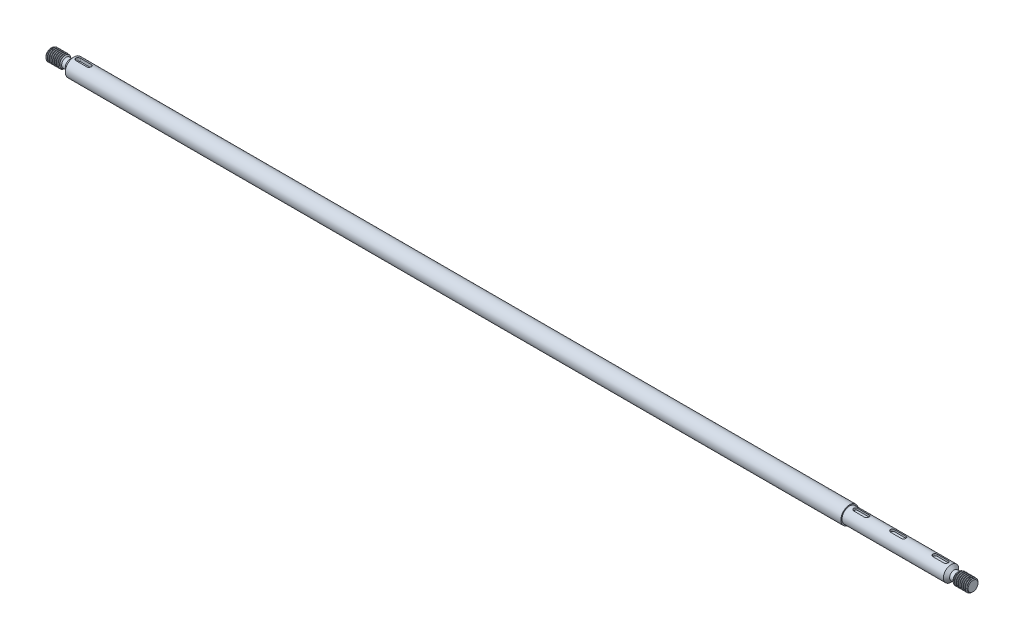
from build123d import *

# Parameters (mm, degrees)
CHAMFER1_SIZE      = 2
THREAD1_PITCH      = 3.175
CHAMFER2_SIZE      = 2
THREAD2_PITCH      = 3.175
SKETCH3_R          = 2.35
CUT_EXTRUDE2_DEPTH = 1683.108534772
CUT_EXTRUDE3_DEPTH = 10


# Read off the part's stored shape, not the designer's step: Revolve1
with BuildPart() as part:
    # Revolve1 outline → Revolve1 (revolve)
    with BuildSketch(Plane(origin=(0, -11.1125, 0), x_dir=(0, 1, 0), z_dir=(0, 0, -1))):
        Polygon((11.1125, -1681.647145633), (11.1125, -1656.647145633), (8.364004428, -1653.89865006), (8.364004428, -1647.283141205), (16, -1639.647145633), (16, -225), (14, -225), (14, -40), (8.364004428, -34.364004428), (8.364004428, -27.748495572), (11.1125, -25), (11.1125, 0), (0, 0), (0, -1681.647145633), align=None)
    revolve(axis=Axis((0, -11.1125, 0), (1, 0, 0)))

    # Chamfer1
    chamfer1_edges = [part.edges().sort_by_distance(p)[0] for p in [
        (0, -22.225, 0),
    ]]
    chamfer(chamfer1_edges, length=CHAMFER1_SIZE)

    # Thread1: the profile of Thread Profile1 profile screwed along a right-hand helix of 9.448819 turns, 12 arcs to a turn; built about Z, then put on its axis
    thread1_z = Axis((0, 0, 0), (0, 0, 1))
    thread1_corners = [(11.1128, 0, -0.000173205), (11.1128, 0, 2.778298196), (9.393980847, 0, 1.785937496), (9.393980847, 0, 0.992187496)]
    with BuildLine(mode=Mode.PRIVATE) as thread1_profile:
        Line(thread1_corners[0], thread1_corners[1])
        Line(thread1_corners[1], thread1_corners[2])
        Line(thread1_corners[2], thread1_corners[3])
        Line(thread1_corners[3], thread1_corners[0])
    thread1_cap = Face(thread1_profile.wire())
    thread1_turn_angles = [0, 15, 30, 45, 60, 75, 90, 105, 120, 135, 150, 165, 180, 195, 210, 225, 240, 255, 270, 285, 300, 315, 330, 345, 360]
    thread1_turn_weights = [1, 0.9659258262890683, 1, 0.9659258262890683, 1, 0.9659258262890683, 1, 0.9659258262890683, 1, 0.9659258262890683, 1, 0.9659258262890683, 1, 0.9659258262890683, 1, 0.9659258262890683, 1, 0.9659258262890683, 1, 0.9659258262890683, 1, 0.9659258262890683, 1, 0.9659258262890683, 1]
    thread1_turn_rails = [Edge.make_bspline([Vector(p[0], p[1], 0).rotate(thread1_z, thread1_turn_angles[k]) / thread1_turn_weights[k] + Vector(0, 0, p[2] + THREAD1_PITCH * thread1_turn_angles[k] / 360) for k in range(25)], [0, 0, 0, 1, 1, 2, 2, 3, 3, 4, 4, 5, 5, 6, 6, 7, 7, 8, 8, 9, 9, 10, 10, 11, 11, 12, 12, 12], 2, thread1_turn_weights) for p in thread1_corners]
    thread1_turn_sides = [Face.make_surface_from_curves(thread1_turn_rails[p[0]], thread1_turn_rails[p[1]]) for p in [(0, 1), (1, 2), (2, 3), (3, 0)]]
    thread1_last_angles = [3240, 3255, 3270, 3285, 3300, 3315, 3330, 3345, 3360, 3375, 3390, 3395.787401575, 3401.57480315]
    thread1_last_weights = [1, 0.9659258262890683, 1, 0.9659258262890683, 1, 0.9659258262890683, 1, 0.9659258262890683, 1, 0.9659258262890683, 1, 0.9949029054407538, 1]
    thread1_last_rails = [Edge.make_bspline([Vector(p[0], p[1], 0).rotate(thread1_z, thread1_last_angles[k]) / thread1_last_weights[k] + Vector(0, 0, p[2] + THREAD1_PITCH * thread1_last_angles[k] / 360) for k in range(13)], [0, 0, 0, 1, 1, 2, 2, 3, 3, 4, 4, 5, 5, 6, 6, 6], 2, thread1_last_weights) for p in thread1_corners]
    thread1_last_sides = [Face.make_surface_from_curves(thread1_last_rails[p[0]], thread1_last_rails[p[1]]) for p in [(0, 1), (1, 2), (2, 3), (3, 0)]]
    thread1 = Plane(origin=(-30, -11.1125, 0), x_dir=(0, 0, -1), z_dir=(1, 0, 0)) * Solid(Shell([*[p.moved(Location((0, 0, THREAD1_PITCH * i))) for i in range(9) for p in thread1_turn_sides], *thread1_last_sides, thread1_cap, thread1_cap.rotate(thread1_z, 3401.57480315).moved(Location((0, 0, THREAD1_PITCH * 3401.57480315 / 360)))]))
    add(thread1, mode=Mode.SUBTRACT)

    # Chamfer2
    chamfer2_edges = [part.edges().sort_by_distance(p)[0] for p in [
        (-1681.647145633, -22.225, 0),
    ]]
    chamfer(chamfer2_edges, length=CHAMFER2_SIZE)

    # Thread2: the profile of Thread Profile2 profile screwed along a right-hand helix of 9.448819 turns, 12 arcs to a turn; built about Z, then put on its axis
    thread2_z = Axis((0, 0, 0), (0, 0, 1))
    thread2_corners = [(11.1128, 0, -0.000173206), (11.1128, 0, 2.778298196), (9.393980847, 0, 1.785937495), (9.393980847, 0, 0.992187495)]
    with BuildLine(mode=Mode.PRIVATE) as thread2_profile:
        Line(thread2_corners[0], thread2_corners[1])
        Line(thread2_corners[1], thread2_corners[2])
        Line(thread2_corners[2], thread2_corners[3])
        Line(thread2_corners[3], thread2_corners[0])
    thread2_cap = Face(thread2_profile.wire())
    thread2_turn_angles = [0, 15, 30, 45, 60, 75, 90, 105, 120, 135, 150, 165, 180, 195, 210, 225, 240, 255, 270, 285, 300, 315, 330, 345, 360]
    thread2_turn_weights = [1, 0.9659258262890683, 1, 0.9659258262890683, 1, 0.9659258262890683, 1, 0.9659258262890683, 1, 0.9659258262890683, 1, 0.9659258262890683, 1, 0.9659258262890683, 1, 0.9659258262890683, 1, 0.9659258262890683, 1, 0.9659258262890683, 1, 0.9659258262890683, 1, 0.9659258262890683, 1]
    thread2_turn_rails = [Edge.make_bspline([Vector(p[0], p[1], 0).rotate(thread2_z, thread2_turn_angles[k]) / thread2_turn_weights[k] + Vector(0, 0, p[2] + THREAD2_PITCH * thread2_turn_angles[k] / 360) for k in range(25)], [0, 0, 0, 1, 1, 2, 2, 3, 3, 4, 4, 5, 5, 6, 6, 7, 7, 8, 8, 9, 9, 10, 10, 11, 11, 12, 12, 12], 2, thread2_turn_weights) for p in thread2_corners]
    thread2_turn_sides = [Face.make_surface_from_curves(thread2_turn_rails[p[0]], thread2_turn_rails[p[1]]) for p in [(0, 1), (1, 2), (2, 3), (3, 0)]]
    thread2_last_angles = [3240, 3255, 3270, 3285, 3300, 3315, 3330, 3345, 3360, 3375, 3390, 3395.787401575, 3401.57480315]
    thread2_last_weights = [1, 0.9659258262890683, 1, 0.9659258262890683, 1, 0.9659258262890683, 1, 0.9659258262890683, 1, 0.9659258262890683, 1, 0.9949029054407538, 1]
    thread2_last_rails = [Edge.make_bspline([Vector(p[0], p[1], 0).rotate(thread2_z, thread2_last_angles[k]) / thread2_last_weights[k] + Vector(0, 0, p[2] + THREAD2_PITCH * thread2_last_angles[k] / 360) for k in range(13)], [0, 0, 0, 1, 1, 2, 2, 3, 3, 4, 4, 5, 5, 6, 6, 6], 2, thread2_last_weights) for p in thread2_corners]
    thread2_last_sides = [Face.make_surface_from_curves(thread2_last_rails[p[0]], thread2_last_rails[p[1]]) for p in [(0, 1), (1, 2), (2, 3), (3, 0)]]
    thread2 = Plane(origin=(-1651.647145633, -11.1125, 0), x_dir=(0, 0, 1), z_dir=(-1, 0, 0)) * Solid(Shell([*[p.moved(Location((0, 0, THREAD2_PITCH * i))) for i in range(9) for p in thread2_turn_sides], *thread2_last_sides, thread2_cap, thread2_cap.rotate(thread2_z, 3401.57480315).moved(Location((0, 0, THREAD2_PITCH * 3401.57480315 / 360)))]))
    add(thread2, mode=Mode.SUBTRACT)

    # Sketch3 → Cut-Extrude2 (cut, through all)
    with BuildSketch(Plane(origin=(0, 8.8875, 0), x_dir=(1, 0, 0), z_dir=(0, 1, 0))):
        with Locations(Location((-4.399213606, 0.04466397, 0), (0, 0, 266.893242176))):
            Circle(SKETCH3_R)
        with Locations(Location((-1677.247932029, 0.04466397, 0), (0, 0, 267.783956531))):
            Circle(SKETCH3_R)
    extrude(amount=-CUT_EXTRUDE2_DEPTH, mode=Mode.SUBTRACT)

    # Sketch4 → Cut-Extrude3 (cut)
    with BuildSketch(Plane(origin=(0, 8.8875, 0), x_dir=(1, 0, 0), z_dir=(0, 1, 0))):
        with BuildLine():
            Line((-213.84275194, 4.312529698), (-193.84275194, 4.312529698))
            ThreePointArc((-193.84275194, 4.312529698), (-189.84275194, 0.312529698), (-193.84275194, -3.687470302))
            Line((-193.84275194, -3.687470302), (-213.84275194, -3.687470302))
            ThreePointArc((-213.84275194, -3.687470302), (-217.84275194, 0.312529698), (-213.84275194, 4.312529698))
        make_face()
        with BuildLine():
            Line((-146.547833428, 4.312529698), (-126.547833428, 4.312529698))
            ThreePointArc((-126.547833428, 4.312529698), (-122.547833428, 0.312529698), (-126.547833428, -3.687470302))
            Line((-126.547833428, -3.687470302), (-146.547833428, -3.687470302))
            ThreePointArc((-146.547833428, -3.687470302), (-150.547833428, 0.312529698), (-146.547833428, 4.312529698))
        make_face()
        with BuildLine():
            Line((-1632.276808966, 4.312529698), (-1612.276808966, 4.312529698))
            ThreePointArc((-1612.276808966, 4.312529698), (-1608.276808966, 0.312529698), (-1612.276808966, -3.687470302))
            Line((-1612.276808966, -3.687470302), (-1632.276808966, -3.687470302))
            ThreePointArc((-1632.276808966, -3.687470302), (-1636.276808966, 0.312529698), (-1632.276808966, 4.312529698))
        make_face()
        with BuildLine():
            Line((-49.370336669, 4.312529698), (-69.370336669, 4.312529698))
            ThreePointArc((-69.370336669, 4.312529698), (-73.370336669, 0.312529698), (-69.370336669, -3.687470302))
            Line((-69.370336669, -3.687470302), (-49.370336669, -3.687470302))
            ThreePointArc((-49.370336669, -3.687470302), (-45.370336669, 0.312529698), (-49.370336669, 4.312529698))
        make_face()
    extrude(amount=-CUT_EXTRUDE3_DEPTH, mode=Mode.SUBTRACT)


solid = part.part
